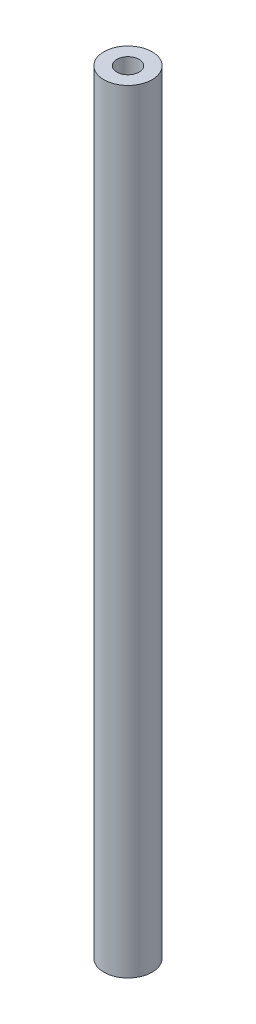
from build123d import *

# Parameters (mm, degrees)
SKETCH1_R           = 6.35
BOSS_EXTRUDE1_DEPTH = 203.2
SKETCH2_R           = 2.921
CUT_EXTRUDE1_DEPTH  = 12.7
SKETCH3_R           = 1.650000002
CUT_EXTRUDE2_DEPTH  = 204.398340701
THREAD1_PITCH       = 0.7
SKETCH7_W           = 6.35
SKETCH7_H           = 6.35
CUT_EXTRUDE3_DEPTH  = 25.4


with BuildPart() as part:
    # Sketch1 → Boss-Extrude1 (new body)
    with BuildSketch(Plane(origin=(0, 0, 0), x_dir=(1, 0, 0), z_dir=(0, 1, 0))):
        with Locations(Location((0, 0, 0), (0, 0, 270))):
            Circle(SKETCH1_R)
    extrude(amount=BOSS_EXTRUDE1_DEPTH)

    # Sketch2 → Cut-Extrude1 (cut)
    with BuildSketch(Plane(origin=(0, 203.2, 0), x_dir=(1, 0, 0), z_dir=(0, 1, 0))):
        with Locations(Location((0, 0, 0), (0, 0, 270))):
            Circle(SKETCH2_R)
    extrude(amount=-CUT_EXTRUDE1_DEPTH, mode=Mode.SUBTRACT)

    # Sketch3 → Cut-Extrude2 (cut, through all)
    with BuildSketch(Plane(origin=(0, 0, 0), x_dir=(0, 0, -1), z_dir=(1, 0, 0))):
        with Locations((0, 196.85)):
            Circle(SKETCH3_R)
    extrude(amount=-CUT_EXTRUDE2_DEPTH, mode=Mode.SUBTRACT)

    # Thread1: the profile of Thread Profile1 profile screwed along a right-hand helix of 10.5 turns, 6 arcs to a turn; built about Z, then put on its axis
    thread1_z = Axis((0, 0, 0), (0, 0, 1))
    thread1_corners = [(1.649700002, 0, -0.000173205), (2.028886114, 0, 0.218749999), (2.028886114, 0, 0.306249999), (1.649700002, 0, 0.525173203)]
    with BuildLine(mode=Mode.PRIVATE) as thread1_profile:
        Line(thread1_corners[0], thread1_corners[1])
        Line(thread1_corners[1], thread1_corners[2])
        Line(thread1_corners[2], thread1_corners[3])
        Line(thread1_corners[3], thread1_corners[0])
    thread1_cap = Face(thread1_profile.wire())
    thread1_turn_angles = [0, 30, 60, 90, 120, 150, 180, 210, 240, 270, 300, 330, 360]
    thread1_turn_weights = [1, 0.8660254037844387, 1, 0.8660254037844387, 1, 0.8660254037844387, 1, 0.8660254037844387, 1, 0.8660254037844387, 1, 0.8660254037844387, 1]
    thread1_turn_rails = [Edge.make_bspline([Vector(p[0], p[1], 0).rotate(thread1_z, thread1_turn_angles[k]) / thread1_turn_weights[k] + Vector(0, 0, p[2] + THREAD1_PITCH * thread1_turn_angles[k] / 360) for k in range(13)], [0, 0, 0, 1, 1, 2, 2, 3, 3, 4, 4, 5, 5, 6, 6, 6], 2, thread1_turn_weights) for p in thread1_corners]
    thread1_turn_sides = [Face.make_surface_from_curves(thread1_turn_rails[p[0]], thread1_turn_rails[p[1]]) for p in [(0, 1), (1, 2), (2, 3), (3, 0)]]
    thread1_last_angles = [3600, 3630, 3660, 3690, 3720, 3750, 3780]
    thread1_last_weights = [1, 0.8660254037844387, 1, 0.8660254037844387, 1, 0.8660254037844367, 1]
    thread1_last_rails = [Edge.make_bspline([Vector(p[0], p[1], 0).rotate(thread1_z, thread1_last_angles[k]) / thread1_last_weights[k] + Vector(0, 0, p[2] + THREAD1_PITCH * thread1_last_angles[k] / 360) for k in range(7)], [0, 0, 0, 1, 1, 2, 2, 3, 3, 3], 2, thread1_last_weights) for p in thread1_corners]
    thread1_last_sides = [Face.make_surface_from_curves(thread1_last_rails[p[0]], thread1_last_rails[p[1]]) for p in [(0, 1), (1, 2), (2, 3), (3, 0)]]
    thread1 = Plane(origin=(-7.35, 196.85, 0), x_dir=(0, 0, -1), z_dir=(1, 0, 0)) * Solid(Shell([*[p.moved(Location((0, 0, THREAD1_PITCH * i))) for i in range(10) for p in thread1_turn_sides], *thread1_last_sides, thread1_cap, thread1_cap.rotate(thread1_z, 3780).moved(Location((0, 0, THREAD1_PITCH * 3780 / 360)))]))
    add(thread1, mode=Mode.SUBTRACT)

    # Sketch7 → Cut-Extrude3 (cut)
    with BuildSketch(Plane.XZ):
        Rectangle(SKETCH7_W, SKETCH7_H)
    extrude(amount=-CUT_EXTRUDE3_DEPTH, mode=Mode.SUBTRACT)


solid = part.part
